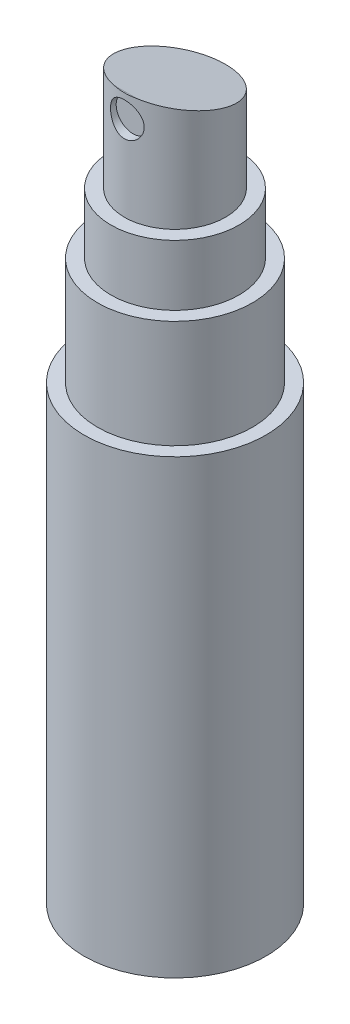
from build123d import *

# Parameters (mm, degrees)
SKETCH1_R           = 13.5
BOSS_EXTRUDE1_DEPTH = 67
SKETCH2_R           = 11.5
BOSS_EXTRUDE2_DEPTH = 16
SKETCH3_R           = 9.5
BOSS_EXTRUDE3_DEPTH = 9
SKETCH4_R           = 7.5
BOSS_EXTRUDE4_DEPTH = 16
CUT_EXTRUDE1_DEPTH  = 111.847868721
SKETCH7_R           = 2.5
CUT_EXTRUDE2_DEPTH  = 1.27


with BuildPart() as part:
    # Sketch1 → Boss-Extrude1 (new body)
    with BuildSketch(Plane(origin=(0, 0, 0), x_dir=(1, 0, 0), z_dir=(0, 1, 0))):
        Circle(SKETCH1_R)
    extrude(amount=BOSS_EXTRUDE1_DEPTH)

    # Sketch2 → Boss-Extrude2 (add)
    with BuildSketch(Plane(origin=(0, 67, 0), x_dir=(1, 0, 0), z_dir=(0, 1, 0))):
        Circle(SKETCH2_R)
    extrude(amount=BOSS_EXTRUDE2_DEPTH)

    # Sketch3 → Boss-Extrude3 (add)
    with BuildSketch(Plane(origin=(0, 83, 0), x_dir=(1, 0, 0), z_dir=(0, 1, 0))):
        Circle(SKETCH3_R)
    extrude(amount=BOSS_EXTRUDE3_DEPTH)

    # Sketch4 → Boss-Extrude4 (add)
    with BuildSketch(Plane(origin=(0, 92, 0), x_dir=(1, 0, 0), z_dir=(0, 1, 0))):
        Circle(SKETCH4_R)
    extrude(amount=BOSS_EXTRUDE4_DEPTH)

    # Sketch6 → Cut-Extrude1 (cut, through all)
    with BuildSketch(Plane(origin=(7.5, 0, 0), x_dir=(0, 0, -1), z_dir=(1, 0, 0))):
        Polygon((-7.319182821, 108), (8.150119574, 104), (7.994537509, 108), align=None)
    extrude(amount=-CUT_EXTRUDE1_DEPTH, mode=Mode.SUBTRACT)

    # Sketch7 → Cut-Extrude2 (cut)
    with BuildSketch(Plane.XY.offset(7.5)):
        with Locations((0, 104.6)):
            Circle(SKETCH7_R)
    extrude(amount=-CUT_EXTRUDE2_DEPTH, mode=Mode.SUBTRACT)


solid = part.part
